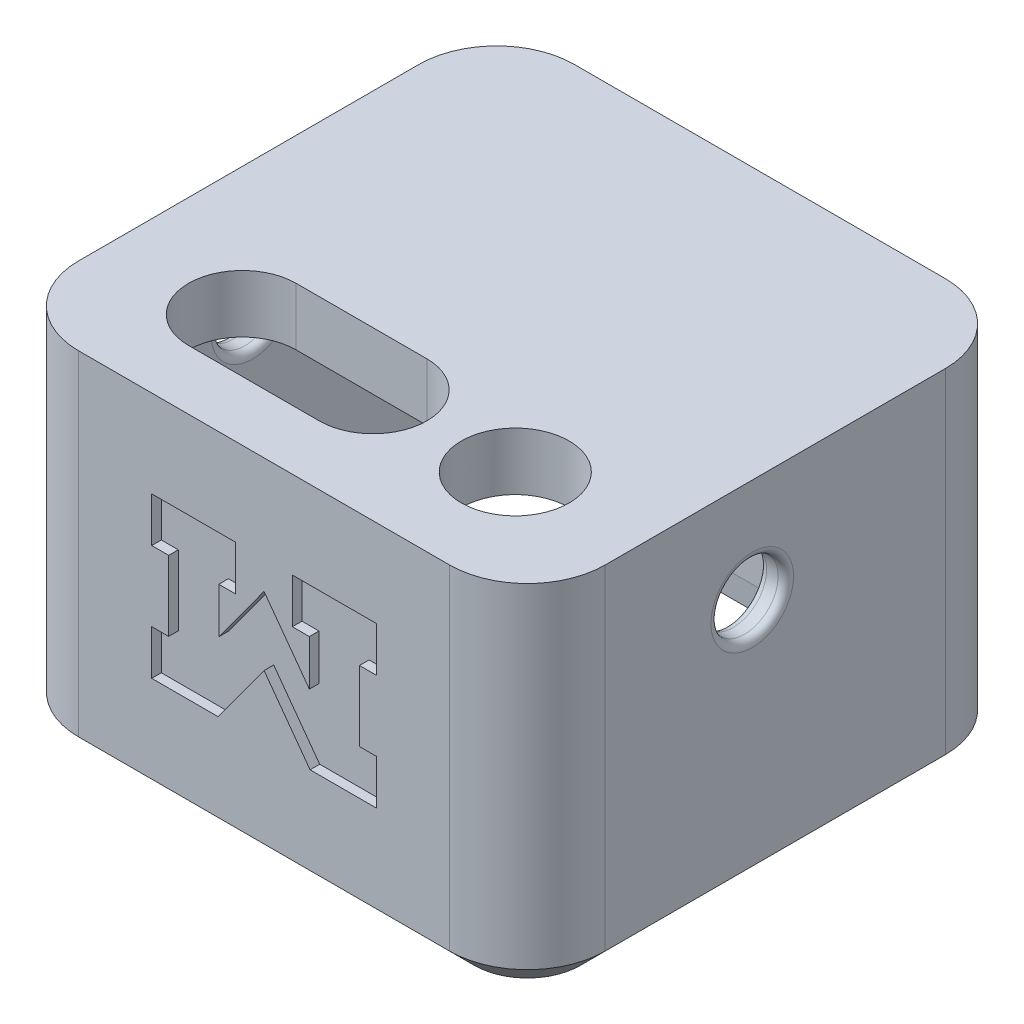
from build123d import *

# Parameters (mm, degrees)
BOSS_EXTRUDE1_DEPTH = 1.778
BOSS_EXTRUDE2_DEPTH = 20.32
SKETCH5_R           = 3.556
SKETCH5_W           = 15.748
SKETCH5_H           = 7.112
CUT_EXTRUDE1_DEPTH  = 1.778
FILLET1_R           = 3.556
SKETCH9_R           = 3.556
BOSS_EXTRUDE3_DEPTH = 2.032
SWEEP2_START        = 13.282231977
SWEEP2_DEPTH        = 14.594268023
CUT_EXTRUDE4_DEPTH  = 0.635
SKETCH17_R          = 2.2225
CUT_EXTRUDE5_DEPTH  = 53.291589362
FILLET2_R           = 0.508
SKETCH19_R          = 2.794
CUT_EXTRUDE6_DEPTH  = 2.54


# Read off the part's stored shape, not the designer's step: Sweep2
with BuildPart() as part:
    # Sketch1 → Boss-Extrude1 (new body)
    with BuildSketch(Plane(origin=(0, 0, 0), x_dir=(1, 0, 0), z_dir=(0, 1, 0))):
        with BuildLine():
            Line((-1.778, 3.3655), (-1.778, 25.8445))
            ThreePointArc((-1.778, 25.8445), (-0.271503729, 29.481503729), (3.3655, 30.988))
            Line((3.3655, 30.988), (27.8765, 30.988))
            ThreePointArc((27.8765, 30.988), (31.513503729, 29.481503729), (33.02, 25.8445))
            Line((33.02, 25.8445), (33.02, 3.3655))
            ThreePointArc((33.02, 3.3655), (31.513503729, -0.271503729), (27.8765, -1.778))
            Line((27.8765, -1.778), (3.3655, -1.778))
            ThreePointArc((3.3655, -1.778), (-0.271503729, -0.271503729), (-1.778, 3.3655))
        make_face()
    extrude(amount=-BOSS_EXTRUDE1_DEPTH)

    # Sketch3 → Boss-Extrude2 (add)
    with BuildSketch(Plane.XZ.offset(1.778)):
        with BuildLine():
            Line((27.8765, 1.778), (3.3655, 1.778))
            ThreePointArc((3.3655, 1.778), (-0.271503729, 0.271503729), (-1.778, -3.3655))
            Line((-1.778, -3.3655), (-1.778, -25.8445))
            ThreePointArc((-1.778, -25.8445), (-0.271503729, -29.481503729), (3.3655, -30.988))
            Line((3.3655, -30.988), (27.8765, -30.988))
            ThreePointArc((27.8765, -30.988), (31.513503729, -29.481503729), (33.02, -25.8445))
            Line((33.02, -25.8445), (33.02, -3.3655))
            ThreePointArc((33.02, -3.3655), (31.513503729, 0.271503729), (27.8765, 1.778))
        make_face()
        with BuildLine():
            Line((0, -3.3655), (0, -25.8445))
            ThreePointArc((0, -25.8445), (0.985732128, -28.224267872), (3.3655, -29.21))
            Line((3.3655, -29.21), (27.8765, -29.21))
            ThreePointArc((27.8765, -29.21), (30.256267872, -28.224267872), (31.242, -25.8445))
            Line((31.242, -25.8445), (31.242, -3.3655))
            ThreePointArc((31.242, -3.3655), (30.256267872, -0.985732128), (27.8765, 0))
            Line((27.8765, 0), (3.3655, 0))
            ThreePointArc((3.3655, 0), (0.985732128, -0.985732128), (0, -3.3655))
        make_face(mode=Mode.SUBTRACT)
    extrude(amount=BOSS_EXTRUDE2_DEPTH)

    # Sketch5 → Cut-Extrude1 (cut)
    with BuildSketch(Plane(origin=(0, 0, 0), x_dir=(1, 0, 0), z_dir=(0, 1, 0))):
        with Locations(Location((24.7269, 5.715, 0), (0, 0, 270))):
            Circle(SKETCH5_R)
        with Locations((11.0109, 5.715)):
            Rectangle(SKETCH5_W, SKETCH5_H)
    extrude(amount=-CUT_EXTRUDE1_DEPTH, mode=Mode.SUBTRACT)

    # Fillet1
    fillet1_edges = [part.edges().sort_by_distance(p)[0] for p in [
        (3.1369, -0.889, -2.159),
        (18.8849, -0.889, -2.159),
        (18.8849, -0.889, -9.271),
        (3.1369, -0.889, -9.271),
    ]]
    fillet(fillet1_edges, radius=FILLET1_R - 0.0001)  # a hair under: the kernel refuses the full size

    # Sketch9 → Boss-Extrude3 (add)
    with BuildSketch(Plane.XZ.offset(1.778)):
        with BuildLine():
            Line((6.6929, -10.541), (15.3289, -10.541))
            ThreePointArc((15.3289, -10.541), (18.327432056, -9.496412634), (20.0279, -6.814852263))
            ThreePointArc((20.0279, -6.814852263), (29.5529, -5.715), (20.0279, -4.615147737))
            ThreePointArc((20.0279, -4.615147737), (18.327432056, -1.933587366), (15.3289, -0.889))
            Line((15.3289, -0.889), (6.6929, -0.889))
            ThreePointArc((6.6929, -0.889), (3.280402674, -2.302502674), (1.8669, -5.715))
            ThreePointArc((1.8669, -5.715), (3.280402674, -9.127497326), (6.6929, -10.541))
        make_face()
        with Locations(Location((24.7269, -5.715, 0), (0, 0, 90))):
            Circle(SKETCH9_R, mode=Mode.SUBTRACT)
        with BuildLine():
            Line((6.6929, -9.271), (15.3289, -9.271))
            ThreePointArc((15.3289, -9.271), (17.843371714, -8.229471714), (18.8849, -5.715))
            ThreePointArc((18.8849, -5.715), (17.843371714, -3.200528286), (15.3289, -2.159))
            Line((15.3289, -2.159), (6.6929, -2.159))
            ThreePointArc((6.6929, -2.159), (4.178428286, -3.200528286), (3.1369, -5.715))
            ThreePointArc((3.1369, -5.715), (4.178428286, -8.229471714), (6.6929, -9.271))
        make_face(mode=Mode.SUBTRACT)
    extrude(amount=BOSS_EXTRUDE3_DEPTH)

    # Sweep1: sweep along a path in Sketch12
    with BuildLine(Plane.XZ.offset(22.098)) as sweep1_path:
        Line((31.242, -25.8445), (31.242, -3.3655))
        ThreePointArc((31.242, -3.3655), (30.256267872, -0.985732128), (27.8765, 0))
        Line((27.8765, 0), (3.3655, 0))
        ThreePointArc((3.3655, 0), (0.985732128, -0.985732128), (0, -3.3655))
        Line((0, -3.3655), (0, -25.8445))
        ThreePointArc((0, -25.8445), (0.985732128, -28.224267872), (3.3655, -29.21))
        Line((3.3655, -29.21), (27.8765, -29.21))
        ThreePointArc((27.8765, -29.21), (30.256267872, -28.224267872), (31.242, -25.8445))
    # Sketch11 → Sweep1 (sweep)
    with BuildSketch(Plane(origin=(0, 0, -9.652), x_dir=(-1, 0, 0), z_dir=(0, 0, -1))):
        Polygon((1.778, -22.098), (0, -22.098), (0.143040428, -23.732959572), align=None)
    sweep(path=sweep1_path.line)

    # Sweep2 outline → Sweep2 (add)
    with BuildSketch(Plane.YZ.offset(SWEEP2_START)):
        Polygon((-17.272, -28.448), (-17.272, -29.21), (-15.494, -29.21), (-16.256, -28.448), align=None)
    extrude(amount=SWEEP2_DEPTH)

    # Sketch16 → Cut-Extrude4 (cut)
    with BuildSketch(Plane.XY.offset(1.778)):
        Polygon((23.045, -16.329), (23.045, -13.369), (21.925, -13.369), (21.925, -8.729), (23.045, -8.729), (23.045, -5.769), (17.493, -5.769), (17.493, -8.729), (18.613, -8.729), (18.613, -11.737), (15.621, -7.642684211), (12.629, -11.737), (12.629, -8.729), (13.749, -8.729), (13.749, -5.769), (8.197, -5.769), (8.197, -8.729), (9.317, -8.729), (9.317, -13.369), (8.197, -13.369), (8.197, -16.329), (12.581, -16.329), (15.621, -12.169), (18.661, -16.329), align=None)
    extrude(amount=-CUT_EXTRUDE4_DEPTH, mode=Mode.SUBTRACT)

    # Sketch17 → Cut-Extrude5 (cut, through all)
    with BuildSketch(Plane(origin=(33.02, 0, 0), x_dir=(0, 0, -1), z_dir=(1, 0, 0))):
        with Locations((13.081, -6.858)):
            Circle(SKETCH17_R)
    extrude(amount=-CUT_EXTRUDE5_DEPTH, mode=Mode.SUBTRACT)

    # Fillet2
    fillet2_edges = [part.edges().sort_by_distance(p)[0] for p in [
        (-1.778, -6.858, -10.8585),
        (31.242, -6.858, -10.8585),
        (0, -6.858, -10.8585),
        (33.02, -6.858, -10.8585),
    ]]
    fillet(fillet2_edges, radius=FILLET2_R)

    # Sketch19 → Cut-Extrude6 (cut)
    with BuildSketch(Plane.ZY.offset(1.778)):
        with Locations((-21.463, -6.4135)):
            Circle(SKETCH19_R)
    extrude(amount=-CUT_EXTRUDE6_DEPTH, mode=Mode.SUBTRACT)

    # Sweep3: sweep along a path in Sketch21
    with BuildLine(Plane(origin=(0, -17.272, 0), x_dir=(-1, 0, 0), z_dir=(0, -1, 0))) as sweep3_path:
        Line((-13.282231977, 0), (-3.3655, 0))
        ThreePointArc((-3.3655, 0), (-0.985732128, 0.985732128), (0, 3.3655))
        Line((0, 3.3655), (0, 16.0655))
    # Sketch20 → Sweep3 (sweep)
    with BuildSketch(Plane(origin=(13.282231977, 0, 0), x_dir=(0, 0, -1), z_dir=(1, 0, 0))):
        Polygon((0, -15.494), (0, -17.272), (0.762, -17.272), (0.762, -16.256), align=None)
    sweep(path=sweep3_path.line)


solid = part.part
